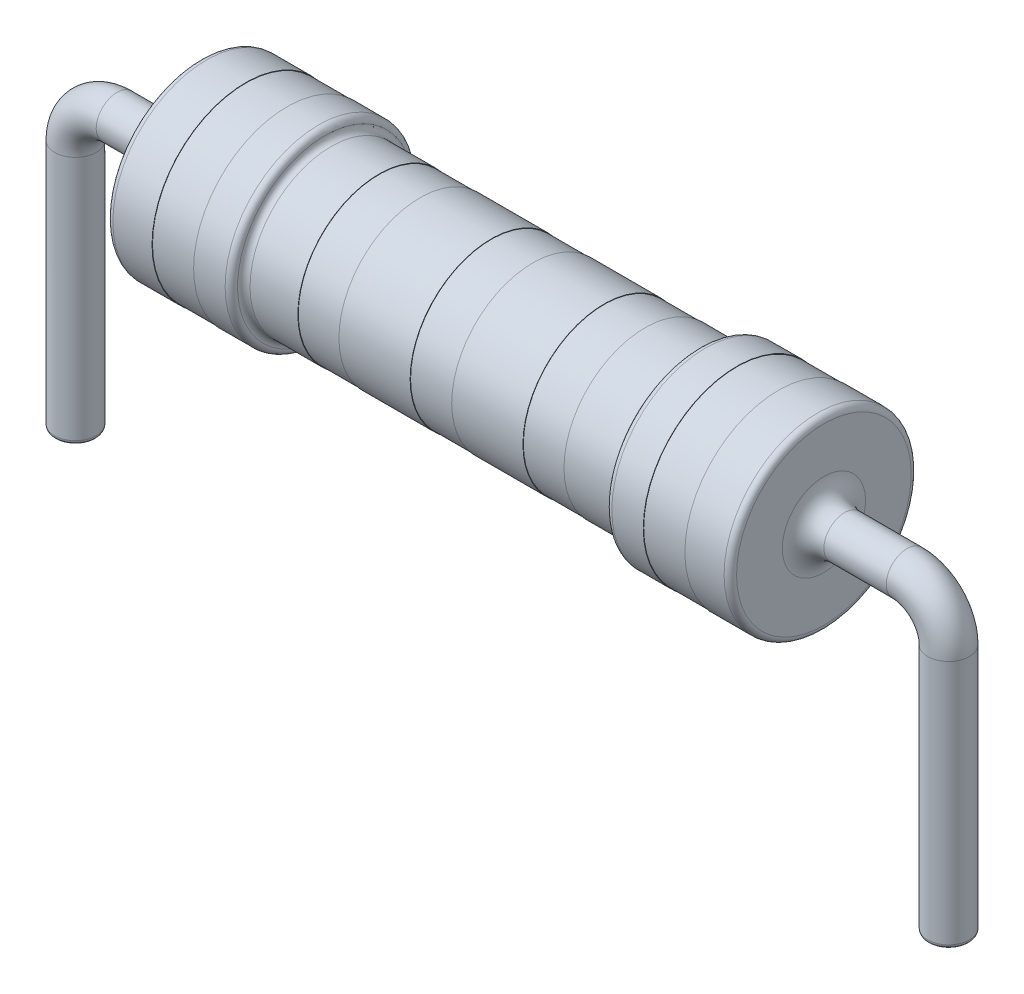
from build123d import *

# Parameters (mm, degrees)
SKETCH3_R = 0.5
FILLET1_R = 0.1
FILLET2_R = 0.15
FILLET3_R = 0.15
FILLET4_R = 0.5


with BuildPart() as part:
    # Sketch1 → Revolve2 (revolve)
    with BuildSketch(Plane.XY, mode=Mode.PRIVATE) as revolve2_sk:
        Polygon((-7.5, -1.897389039), (7.5, -1.897389039), (7.5, -4.147389039), (6.406849222, -4.147389039), (6.406849222, -4.137389039), (5.406849222, -4.137389039), (5.406849222, -4.147389039), (4.5, -4.147389039), (4.5, -3.847389039), (3.2, -3.847389039), (3.2, -3.837389039), (2.212680485, -3.837389039), (2.212680485, -3.847389039), (0.5, -3.847389039), (0.5, -3.837389039), (-0.5, -3.837389039), (-0.5, -3.847389039), (-2.212680485, -3.847389039), (-2.212680485, -3.837389039), (-3.2, -3.837389039), (-3.2, -3.847389039), (-4.5, -3.847389039), (-4.5, -4.147389039), (-5.406849222, -4.147389039), (-5.406849222, -4.137389039), (-6.406849222, -4.137389039), (-6.406849222, -4.147389039), (-7.5, -4.147389039), align=None)
    revolve(revolve2_sk.sketch.rotate(Axis((-7.5, -1.897389039, 0), (1, 0, 0)), 270), axis=Axis((-7.5, -1.897389039, 0), (1, 0, 0)))

    # Sweep1: sweep along a curve in space
    with BuildLine() as sweep1_path:
        Line((7.5, -1.897389039, 0), (9.5, -1.897389039, 0))
        ThreePointArc((10.5, -2.897389039, 0), (10.207106781, -2.190282258, 0), (9.5, -1.897389039, 0))
        Line((10.5, -2.897389039, 0), (10.5, -8.897389039, 0))
    # Sketch3 → Sweep1 (sweep)
    with BuildSketch(Plane(origin=(7.5, 0, 0), x_dir=(0, 0, -1), z_dir=(1, 0, 0))):
        with Locations((0, -1.897389039)):
            Circle(SKETCH3_R)
    sweep1 = sweep(path=sweep1_path.line)

    # Mirror1: Sweep1 across plane
    add(sweep1.mirror(Plane(origin=(0, 0, 0), x_dir=(0, 0, 1), z_dir=(1, 0, 0))))

    # Fillet1
    fillet1_edges = [part.edges().sort_by_distance(p)[0] for p in [
        (10.5, -8.897389039, 0.5),
        (-10.5, -8.897389039, 0.5),
    ]]
    fillet(fillet1_edges, radius=FILLET1_R)

    # Fillet2
    fillet2_edges = [part.edges().sort_by_distance(p)[0] for p in [
        (-7.5, -1.897389039, -2.25),
        (7.5, -1.897389039, -2.25),
        (4.5, -1.897389039, -2.25),
        (-4.5, -1.897389039, -2.25),
    ]]
    fillet(fillet2_edges, radius=FILLET2_R)

    # Fillet3
    fillet3_edges = [part.edges().sort_by_distance(p)[0] for p in [
        (4.5, -1.897389039, -1.95),
        (-4.5, -1.897389039, -1.95),
    ]]
    fillet(fillet3_edges, radius=FILLET3_R - 0.0001)  # a hair under: the kernel refuses the full size

    # Fillet4
    fillet4_edges = [part.edges().sort_by_distance(p)[0] for p in [
        (7.5, -1.897389039, 0.5),
        (-7.5, -1.897389039, 0.5),
    ]]
    fillet(fillet4_edges, radius=FILLET4_R)


solid = part.part
